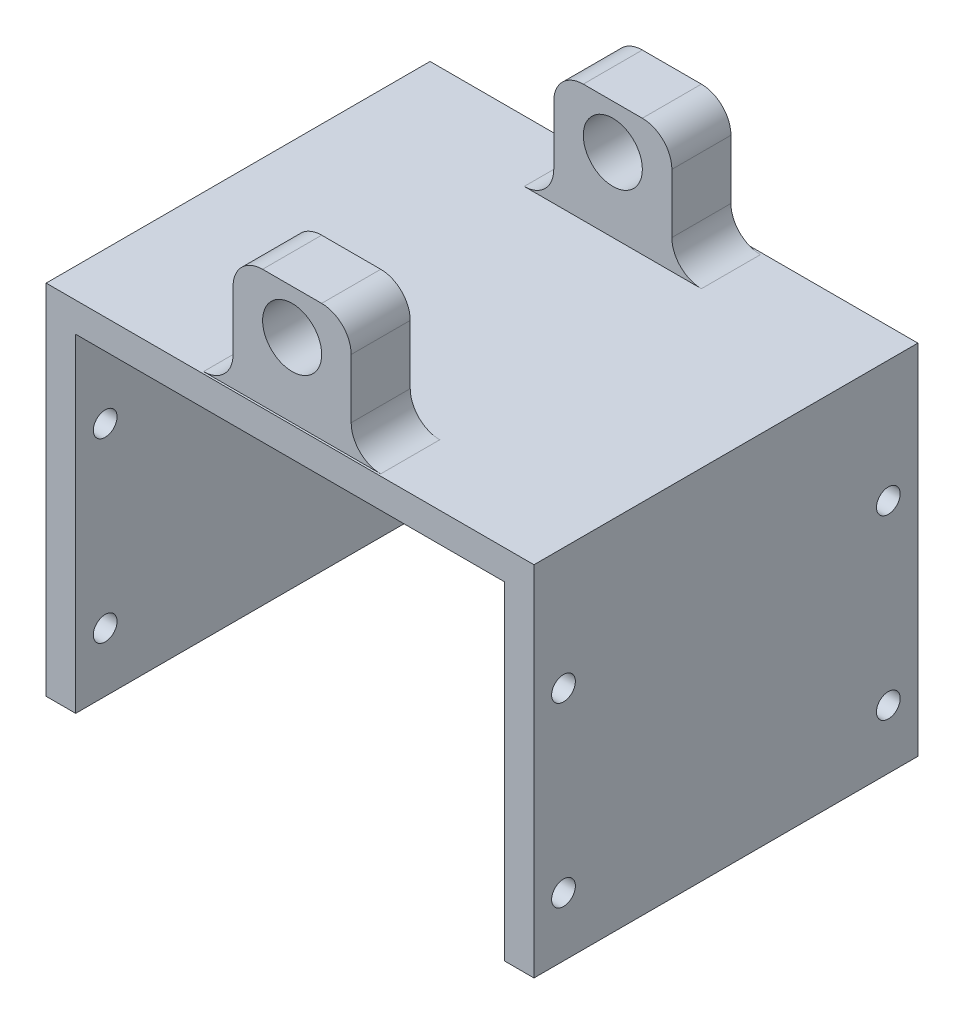
from build123d import *

# Parameters (mm, degrees)
SKETCH1_R                   = 6.35
BOSS_EXTRUDE1_DEPTH         = 82.55
FILLET1_R                   = 6.35
SKETCH3_W                   = 136.608571953
SKETCH3_H                   = 24.259466636
SKETCH3_H_2                 = 56.261
SKETCH3_H_3                 = 27.79521791
CUT_EXTRUDE3_DEPTH          = 31.75
TAP_DRILL_FOR_1_4_20_TAP1_D = 5.1054


with BuildPart() as part:
    # Sketch1 → Boss-Extrude1 (new body)
    with BuildSketch(Plane.XY):
        Polygon((98.552, 70.612), (98.552, 0), (104.902, 0), (104.902, 76.962), (65.151, 76.962), (65.151, 102.362), (39.751, 102.362), (39.751, 76.962), (0, 76.962), (0, 0), (6.35, 0), (6.35, 70.612), align=None)
        with Locations((52.451, 92.837)):
            Circle(SKETCH1_R, mode=Mode.SUBTRACT)
    extrude(amount=BOSS_EXTRUDE1_DEPTH)

    # Fillet1
    fillet1_edges = [part.edges().sort_by_distance(p)[0] for p in [
        (65.151, 102.362, 41.275),
        (39.751, 102.362, 41.275),
        (65.151, 76.962, 41.275),
        (39.751, 76.962, 41.275),
    ]]
    fillet(fillet1_edges, radius=FILLET1_R)

    # Sketch3 → Cut-Extrude3 (cut)
    with BuildSketch(Plane(origin=(0, 108.712, 0), x_dir=(1, 0, 0), z_dir=(0, 1, 0))):
        with Locations((56.578258919, -94.235233318)):
            Rectangle(SKETCH3_W, SKETCH3_H)
        with Locations((56.578258919, -41.275)):
            Rectangle(SKETCH3_W, SKETCH3_H_2)
        with Locations((56.578258919, 13.453108955)):
            Rectangle(SKETCH3_W, SKETCH3_H_3)
    extrude(amount=-CUT_EXTRUDE3_DEPTH, mode=Mode.SUBTRACT)

    # Tap Drill for 1/4-20 Tap1 (through all)
    with Locations(Plane.ZY):
        with Locations((6.35, 50.8), (6.35, 12.7), (76.2, 12.7), (76.2, 50.8)):
            Hole(TAP_DRILL_FOR_1_4_20_TAP1_D / 2)


solid = part.part
